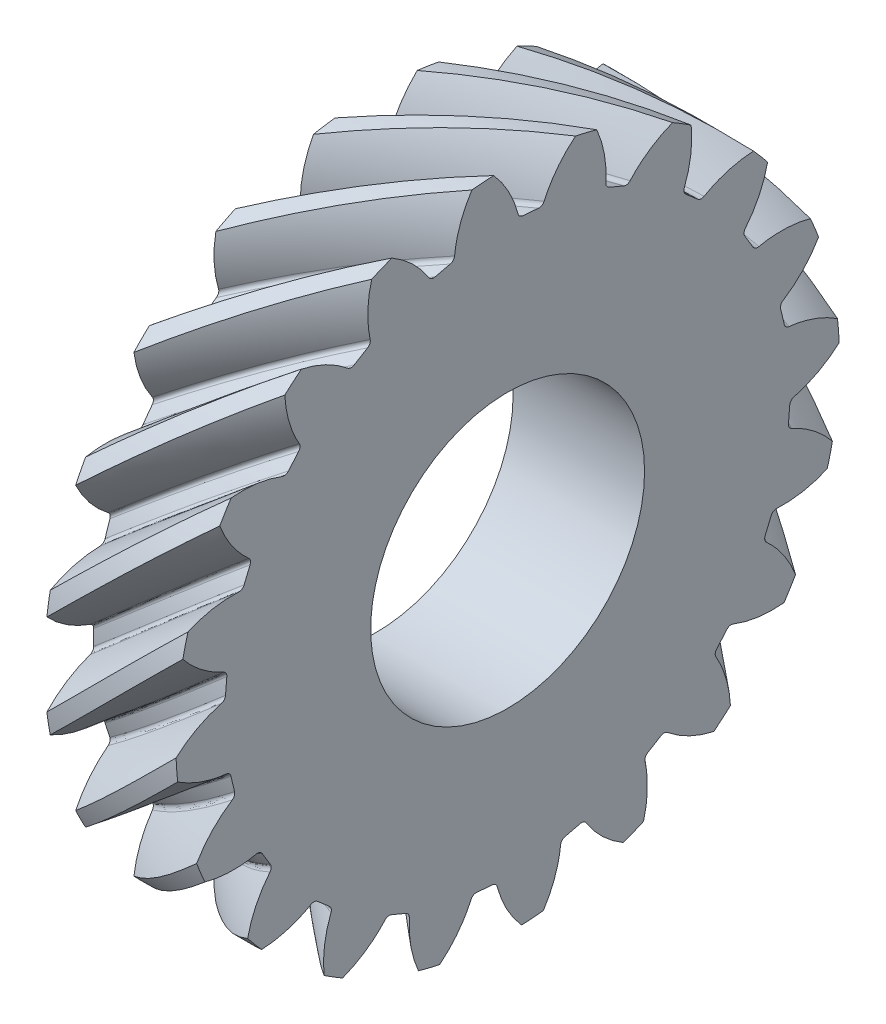
from build123d import *

# Parameters (mm, degrees)
BASPROSKE_W            = 12
BASPROSKE_H            = 30.284271247
TOOTHCUTLH_PITCH       = 190.281688141
TOOTHCUTLH_HEIGHT      = 12
TOOTHCUTLH_RADIUS      = 30.284271247
TOOTHCUTLH_START_ANGLE = -90
TEETHCUTSLH_COUNT      = 20
TEETHCUTSLH_ANGLE      = 342
BORSKE_R               = 1.5
BORE_DEPTH             = 62.5000025
SKETCH3_R              = 12.5
CUT_EXTRUDE1_DEPTH     = 45.477794285


with BuildPart() as part:
    # BasProSke → Base-Revolve (revolve)
    with BuildSketch(Plane(origin=(0, 0, 0), x_dir=(1, 0, 0), z_dir=(0, 1, 0)), mode=Mode.PRIVATE) as base_revolve_sk:
        with Locations((6, 15.142135624)):
            Rectangle(BASPROSKE_W, BASPROSKE_H)
    revolve(base_revolve_sk.sketch.rotate(Axis((-10, 0, 0), (1, 0, 0)), 180), axis=Axis((-10, 0, 0), (1, 0, 0)))

    # ToothCutLH: sweep along a helix
    with BuildLine() as toothcutlh_path:
        add(Helix(TOOTHCUTLH_PITCH, TOOTHCUTLH_HEIGHT, TOOTHCUTLH_RADIUS, center=(0, 0, 0), direction=(1, 0, 0), lefthand=True, mode=Mode.PRIVATE).rotate(Axis((0, 0, 0), (1, 0, 0)), TOOTHCUTLH_START_ANGLE))
    # TooCutSkeRH<3> → ToothCutLH (sweep, cut)
    with BuildSketch(Plane(origin=(0, 0, 0), x_dir=(0, 0, -1), z_dir=(1, 0, 0))):
        with BuildLine():
            ThreePointArc((0.709729235, 25.774501512), (0, 25.784271247), (-0.709729235, 25.774501512))
            ThreePointArc((-0.709729235, 25.774501512), (-1.007455511, 25.862538868), (-1.196142332, 26.109092706))
            ThreePointArc((-1.196142332, 26.109092706), (-2.588726145, 28.736284217), (-4.692249269, 30.837858717))
            ThreePointArc((-4.692249269, 30.837858717), (0, 31.192799385), (4.692249269, 30.837858717))
            ThreePointArc((4.692249269, 30.837858717), (2.588726145, 28.736284217), (1.196142332, 26.109092706))
            ThreePointArc((1.196142332, 26.109092706), (1.007455511, 25.862538868), (0.709729235, 25.774501512))
        make_face()
    toothcutlh = sweep(path=toothcutlh_path.line, is_frenet=True, mode=Mode.SUBTRACT)

    # TeethCutsLH: ToothCutLH ×20 about axis
    teethcutslh_axis = Axis((-10, 0, 0), (1, 0, 0))
    for i in range(1, TEETHCUTSLH_COUNT):
        add(toothcutlh.rotate(teethcutslh_axis, i * TEETHCUTSLH_ANGLE / (TEETHCUTSLH_COUNT - 1)), mode=Mode.SUBTRACT)

    # BorSke → Bore (cut, symmetric)
    with BuildSketch(Plane(origin=(0, 0, 0), x_dir=(0, 0, -1), z_dir=(1, 0, 0))):
        with Locations(Location((0, 0, 0), (0, 0, 180))):
            Circle(BORSKE_R)
    extrude(amount=BORE_DEPTH, both=True, mode=Mode.SUBTRACT)

    # Sketch3 → Cut-Extrude1 (cut, through all)
    with BuildSketch(Plane(origin=(12, 0, 0), x_dir=(0, 0, -1), z_dir=(1, 0, 0))):
        Circle(SKETCH3_R)
    extrude(amount=-CUT_EXTRUDE1_DEPTH, mode=Mode.SUBTRACT)


solid = part.part
